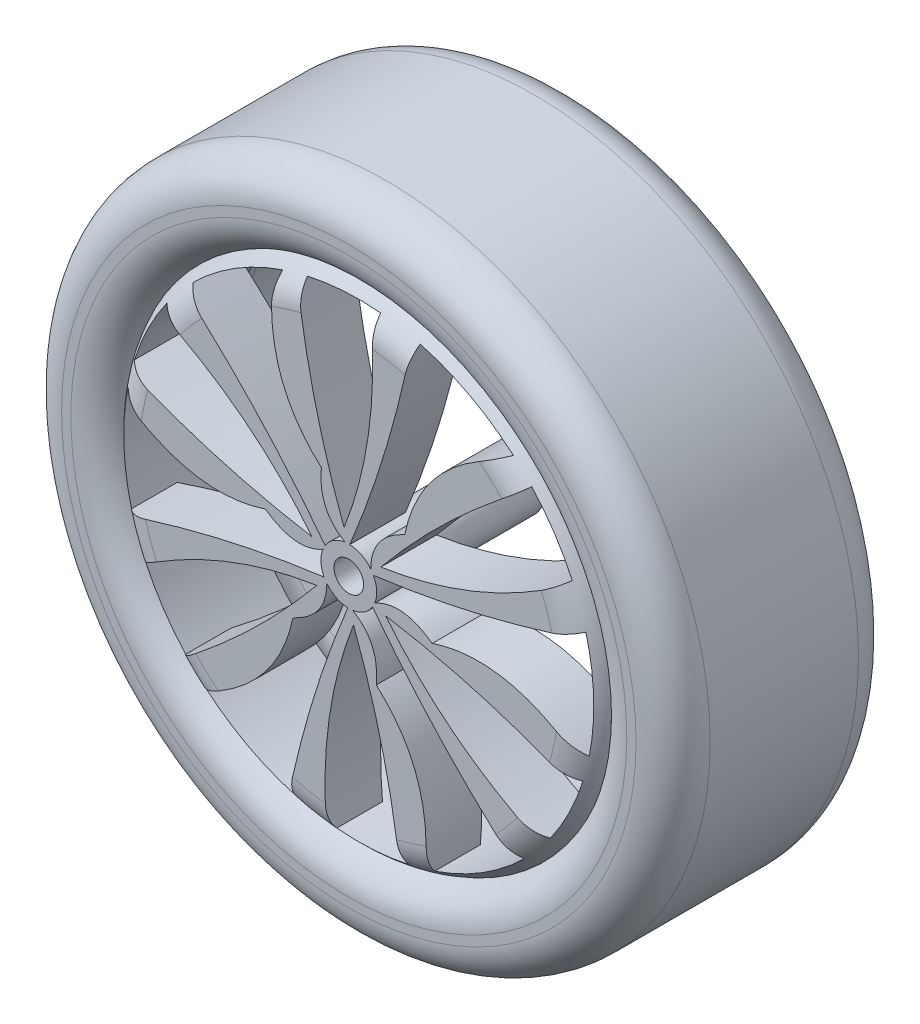
from build123d import *

# Parameters (mm, degrees)
SKETCH1_R             = 175
SKETCH1_R_2           = 130
BOSS_EXTRUDE2_DEPTH   = 120
FILLET1_R             = 20
BOSS_EXTRUDE3_DEPTH   = 30
BOSS_EXTRUDE3_2_DEPTH = 30
BOSS_EXTRUDE3_3_DEPTH = 30
BOSS_EXTRUDE3_4_DEPTH = 30
BOSS_EXTRUDE3_5_DEPTH = 30
BOSS_EXTRUDE3_6_DEPTH = 30
SKETCH3_R             = 131.592715022
SKETCH3_R_2           = 126.810990431
BOSS_EXTRUDE4_DEPTH   = 60
FILLET3_R             = 20
SKETCH4_R             = 15.055598614
BOSS_EXTRUDE5_DEPTH   = 90
SKETCH5_R             = 8
CUT_EXTRUDE1_DEPTH    = 90


with BuildPart() as part:
    # Sketch1 → Boss-Extrude2 (new body)
    with BuildSketch(Plane.XY):
        Circle(SKETCH1_R)
        Circle(SKETCH1_R_2, mode=Mode.SUBTRACT)
    extrude(amount=BOSS_EXTRUDE2_DEPTH)

    # Fillet1
    fillet1_edges = [part.edges().sort_by_distance(p)[0] for p in [
        (-175, 0, 0),
        (-175, 0, 120),
        (-130, 0, 0),
        (-130, 0, 120),
    ]]
    fillet(fillet1_edges, radius=FILLET1_R)



with BuildPart() as body_2:
    # Sketch2 → Boss-Extrude3 (new body)
    with BuildSketch(Plane.XY.offset(120)):
        with BuildLine():
            add(Edge.make_bspline(
                [(14.820083095, -43.417264871), (16.88601474, -22.055442223), (0, -13.786362493)],
                knots=[0, 0, 0, 1, 1, 1], degree=2))
            add(Edge.make_bspline(
                [(0, -13.786362493), (-14.672879255, -48.827424757), (-25.734243788, -85.029360523), (-33.1840936, -122.39216979)],
                knots=[0, 0, 0, 0, 0.972799728, 0.972799728, 0.972799728, 0.972799728], degree=3))
            ThreePointArc((-33.1840936, -122.39216979), (-22.585039748, -124.783585754), (-11.820177896, -126.258903403))
            add(Edge.make_bspline(
                [(2.552466878, -21.426444145), (-10.378665984, -54.726586588), (-15.169547576, -89.670739674), (-11.820177896, -126.258903403)],
                knots=[0, 0, 0, 0, 0.971441578, 0.971441578, 0.971441578, 0.971441578], degree=3))
            add(Edge.make_bspline(
                [(27.640397604, -123.762012404), (23.315856085, -88.604498904), (14.95321251, -54.492642818), (2.552466878, -21.426444145)],
                knots=[0.029262499, 0.029262499, 0.029262499, 0.029262499, 1, 1, 1, 1], degree=3))
            ThreePointArc((27.640397604, -123.762012404), (34.362231788, -122.066638852), (40.98137616, -120.006475251))
            add(Edge.make_bspline(
                [(40.98137616, -120.006475251), (44.465970214, -87.460406335), (35.745539193, -61.930669542), (14.820083095, -43.417264871)],
                knots=[0.034382853, 0.034382853, 0.034382853, 0.034382853, 1, 1, 1, 1], degree=3))
        make_face()
    extrude(amount=-BOSS_EXTRUDE3_DEPTH)


with BuildPart() as body_3:
    # Sketch2 → Boss-Extrude3 2 (new body)
    with BuildSketch(Plane.XY.offset(120)):
        with BuildLine():
            add(Edge.make_bspline(
                [(45.010495889, -8.874063989), (27.543580627, 3.595996622), (11.939340145, -6.893181247)],
                knots=[0, 0, 0, 1, 1, 1], degree=2))
            add(Edge.make_bspline(
                [(11.939340145, -6.893181247), (34.949350614, -37.12079856), (60.770464386, -64.801189129), (89.402681462, -89.934352955)],
                knots=[0, 0, 0, 0, 0.972799728, 0.972799728, 0.972799728, 0.972799728], degree=3))
            ThreePointArc((89.402681462, -89.934352955), (96.773235364, -81.951011045), (103.433328853, -73.366026037))
            add(Edge.make_bspline(
                [(19.832078382, -8.502720913), (42.205281255, -36.351481693), (70.072364746, -57.972583401), (103.433328853, -73.366026037)],
                knots=[0, 0, 0, 0, 0.971441578, 0.971441578, 0.971441578, 0.971441578], degree=3))
            add(Edge.make_bspline(
                [(121.001245568, -37.943719706), (88.391674983, -24.110125771), (54.668619254, -14.296459507), (19.832078382, -8.502720913)],
                knots=[0.029262499, 0.029262499, 0.029262499, 0.029262499, 1, 1, 1, 1], degree=3))
            ThreePointArc((121.001245568, -37.943719706), (122.893926094, -31.274753767), (124.419344266, -24.512324789))
            add(Edge.make_bspline(
                [(124.419344266, -24.512324789), (97.975918818, -5.221543358), (71.506302693, -0.008789758), (45.010495889, -8.874063989)],
                knots=[0.034382853, 0.034382853, 0.034382853, 0.034382853, 1, 1, 1, 1], degree=3))
        make_face()
    extrude(amount=-BOSS_EXTRUDE3_2_DEPTH)


with BuildPart() as body_4:
    # Sketch2 → Boss-Extrude3 3 (new body)
    with BuildSketch(Plane.XY.offset(120)):
        with BuildLine():
            add(Edge.make_bspline(
                [(-45.010495889, 8.874063989), (-27.543580627, -3.595996622), (-11.939340145, 6.893181247)],
                knots=[0, 0, 0, 1, 1, 1], degree=2))
            add(Edge.make_bspline(
                [(-11.939340145, 6.893181247), (-34.949350614, 37.12079856), (-60.770464386, 64.801189129), (-89.402681462, 89.934352955)],
                knots=[0, 0, 0, 0, 0.972799728, 0.972799728, 0.972799728, 0.972799728], degree=3))
            ThreePointArc((-89.402681462, 89.934352955), (-96.773235364, 81.951011045), (-103.433328853, 73.366026037))
            add(Edge.make_bspline(
                [(-19.832078382, 8.502720913), (-42.205281255, 36.351481693), (-70.072364746, 57.972583401), (-103.433328853, 73.366026037)],
                knots=[0, 0, 0, 0, 0.971441578, 0.971441578, 0.971441578, 0.971441578], degree=3))
            add(Edge.make_bspline(
                [(-121.001245568, 37.943719706), (-88.391674983, 24.110125771), (-54.668619254, 14.296459507), (-19.832078382, 8.502720913)],
                knots=[0.029262499, 0.029262499, 0.029262499, 0.029262499, 1, 1, 1, 1], degree=3))
            ThreePointArc((-121.001245568, 37.943719706), (-122.893926094, 31.274753767), (-124.419344266, 24.512324789))
            add(Edge.make_bspline(
                [(-124.419344266, 24.512324789), (-97.975918818, 5.221543358), (-71.506302693, 0.008789758), (-45.010495889, 8.874063989)],
                knots=[0.034382853, 0.034382853, 0.034382853, 0.034382853, 1, 1, 1, 1], degree=3))
        make_face()
    extrude(amount=-BOSS_EXTRUDE3_3_DEPTH)


with BuildPart() as body_5:
    # Sketch2 → Boss-Extrude3 4 (new body)
    with BuildSketch(Plane.XY.offset(120)):
        with BuildLine():
            add(Edge.make_bspline(
                [(83.437968106, 95.494150462), (53.509948604, 82.238862977), (35.7607635, 61.921879784), (30.190412794, 34.543200882)],
                knots=[0.034382853, 0.034382853, 0.034382853, 0.034382853, 1, 1, 1, 1], degree=3))
            add(Edge.make_bspline(
                [(30.190412794, 34.543200882), (10.657565887, 25.651438845), (11.939340145, 6.893181247)],
                knots=[0, 0, 0, 1, 1, 1], degree=2))
            add(Edge.make_bspline(
                [(11.939340145, 6.893181247), (49.622229869, 11.706626197), (86.504708175, 20.228171394), (122.586775063, 32.457816836)],
                knots=[0, 0, 0, 0, 0.972799728, 0.972799728, 0.972799728, 0.972799728], degree=3))
            ThreePointArc((122.586775063, 32.457816836), (119.358275112, 42.832574709), (115.253506749, 52.892877366))
            add(Edge.make_bspline(
                [(17.279611503, 12.923723232), (52.583947239, 18.375104894), (85.241912321, 31.698156272), (115.253506749, 52.892877366)],
                knots=[0, 0, 0, 0, 0.971441578, 0.971441578, 0.971441578, 0.971441578], degree=3))
            add(Edge.make_bspline(
                [(93.360847963, 85.818292698), (65.075818898, 64.494373133), (39.715406744, 40.196183311), (17.279611503, 12.923723232)],
                knots=[0.029262499, 0.029262499, 0.029262499, 0.029262499, 1, 1, 1, 1], degree=3))
            ThreePointArc((93.360847963, 85.818292698), (88.531694306, 90.791885085), (83.437968106, 95.494150462))
        make_face()
    extrude(amount=-BOSS_EXTRUDE3_4_DEPTH)


with BuildPart() as body_6:
    # Sketch2 → Boss-Extrude3 5 (new body)
    with BuildSketch(Plane.XY.offset(120)):
        with BuildLine():
            add(Edge.make_bspline(
                [(-2.552466878, 21.426444145), (10.378665984, 54.726586588), (15.169547576, 89.670739674), (11.820177896, 126.258903403)],
                knots=[0, 0, 0, 0, 0.971441578, 0.971441578, 0.971441578, 0.971441578], degree=3))
            ThreePointArc((11.820177896, 126.258903403), (22.585039748, 124.783585754), (33.1840936, 122.39216979))
            add(Edge.make_bspline(
                [(0, 13.786362493), (14.672879255, 48.827424757), (25.734243788, 85.029360523), (33.1840936, 122.39216979)],
                knots=[0, 0, 0, 0, 0.972799728, 0.972799728, 0.972799728, 0.972799728], degree=3))
            add(Edge.make_bspline(
                [(-14.820083095, 43.417264871), (-16.88601474, 22.055442223), (0, 13.786362493)],
                knots=[0, 0, 0, 1, 1, 1], degree=2))
            add(Edge.make_bspline(
                [(-40.98137616, 120.006475251), (-44.465970214, 87.460406335), (-35.745539193, 61.930669542), (-14.820083095, 43.417264871)],
                knots=[0.034382853, 0.034382853, 0.034382853, 0.034382853, 1, 1, 1, 1], degree=3))
            ThreePointArc((-40.98137616, 120.006475251), (-34.362231788, 122.066638852), (-27.640397604, 123.762012404))
            add(Edge.make_bspline(
                [(-27.640397604, 123.762012404), (-23.315856085, 88.604498904), (-14.95321251, 54.492642818), (-2.552466878, 21.426444145)],
                knots=[0.029262499, 0.029262499, 0.029262499, 0.029262499, 1, 1, 1, 1], degree=3))
        make_face()
    extrude(amount=-BOSS_EXTRUDE3_5_DEPTH)


with BuildPart() as body_7:
    # Sketch2 → Boss-Extrude3 6 (new body)
    with BuildSketch(Plane.XY.offset(120)):
        with BuildLine():
            add(Edge.make_bspline(
                [(-93.360847963, -85.818292698), (-65.075818898, -64.494373133), (-39.715406744, -40.196183311), (-17.279611503, -12.923723232)],
                knots=[0.029262499, 0.029262499, 0.029262499, 0.029262499, 1, 1, 1, 1], degree=3))
            add(Edge.make_bspline(
                [(-17.279611503, -12.923723232), (-52.583947239, -18.375104894), (-85.241912321, -31.698156272), (-115.253506749, -52.892877366)],
                knots=[0, 0, 0, 0, 0.971441578, 0.971441578, 0.971441578, 0.971441578], degree=3))
            ThreePointArc((-115.253506749, -52.892877366), (-119.358275112, -42.832574709), (-122.586775063, -32.457816836))
            add(Edge.make_bspline(
                [(-11.939340145, -6.893181247), (-49.622229869, -11.706626197), (-86.504708175, -20.228171394), (-122.586775063, -32.457816836)],
                knots=[0, 0, 0, 0, 0.972799728, 0.972799728, 0.972799728, 0.972799728], degree=3))
            add(Edge.make_bspline(
                [(-30.190412794, -34.543200882), (-10.657565887, -25.651438845), (-11.939340145, -6.893181247)],
                knots=[0, 0, 0, 1, 1, 1], degree=2))
            add(Edge.make_bspline(
                [(-83.437968106, -95.494150462), (-53.509948604, -82.238862977), (-35.7607635, -61.921879784), (-30.190412794, -34.543200882)],
                knots=[0.034382853, 0.034382853, 0.034382853, 0.034382853, 1, 1, 1, 1], degree=3))
            ThreePointArc((-83.437968106, -95.494150462), (-88.531694306, -90.791885085), (-93.360847963, -85.818292698))
        make_face()
    extrude(amount=-BOSS_EXTRUDE3_6_DEPTH)


with BuildPart() as part_1:
    add(part.part)

    add(body_2.part)  # Boss-Extrude4 merges body 2

    add(body_3.part)  # Boss-Extrude4 merges body 3

    add(body_4.part)  # Boss-Extrude4 merges body 4

    add(body_5.part)  # Boss-Extrude4 merges body 5

    add(body_6.part)  # Boss-Extrude4 merges body 6

    add(body_7.part)  # Boss-Extrude4 merges body 7
    # Sketch3 → Boss-Extrude4 (add)
    with BuildSketch(Plane.XY.offset(120)):
        Circle(SKETCH3_R)
        Circle(SKETCH3_R_2, mode=Mode.SUBTRACT)
    extrude(amount=-BOSS_EXTRUDE4_DEPTH)

    # Fillet2: read off the stored shape, not the designer's step
    # Fillet2 outline → Fillet2 (revolve, cut)
    with BuildSketch(Plane.XZ):
        with BuildLine():
            Line((131.592715022, 120), (113.185430044, 120))
            ThreePointArc((113.185430044, 120), (124.221170105, 116.679701475), (131.592715022, 107.82124413))
            Line((131.592715022, 107.82124413), (131.592715022, 120))
        make_face()
    revolve(axis=Axis((0, 0, 0), (0, 0, 1)), mode=Mode.SUBTRACT)

    # Fillet3
    # the kernel refuses this fillet: 20 mm, written as the material it adds along each edge
    with BuildSketch(Plane(origin=(0, 0, 60), x_dir=(1, 0, 0), z_dir=(0, 1, 0))) as fillet3_piece_1:
        with BuildLine():
            CenterArc((110, 10.834694307), FILLET3_R, 327.198193308, 32.801806692)
            Line((126.810990431, 0), (127.147210239, -0.216693886))
            ThreePointArc((127.147210239, -0.216693886), (128.405495215, -0.4), (130, -0.4))
            Line((130, -0.4), (130.4, 0))
            Line((130.4, 0), (130.4, 10.834694307))
            Line((130.4, 10.834694307), (130, 10.834694307))
        make_face()
    revolve(axis=Axis((0, 0, 60), (0, 0, -1)))

    # Sketch4 → Boss-Extrude5 (add)
    with BuildSketch(Plane.XY.offset(120)):
        Circle(SKETCH4_R)
    extrude(amount=-BOSS_EXTRUDE5_DEPTH)

    # Sketch5 → Cut-Extrude1 (cut)
    with BuildSketch(Plane.XY.offset(120)):
        Circle(SKETCH5_R)
    extrude(amount=-CUT_EXTRUDE1_DEPTH, mode=Mode.SUBTRACT)


solid = part_1.part
